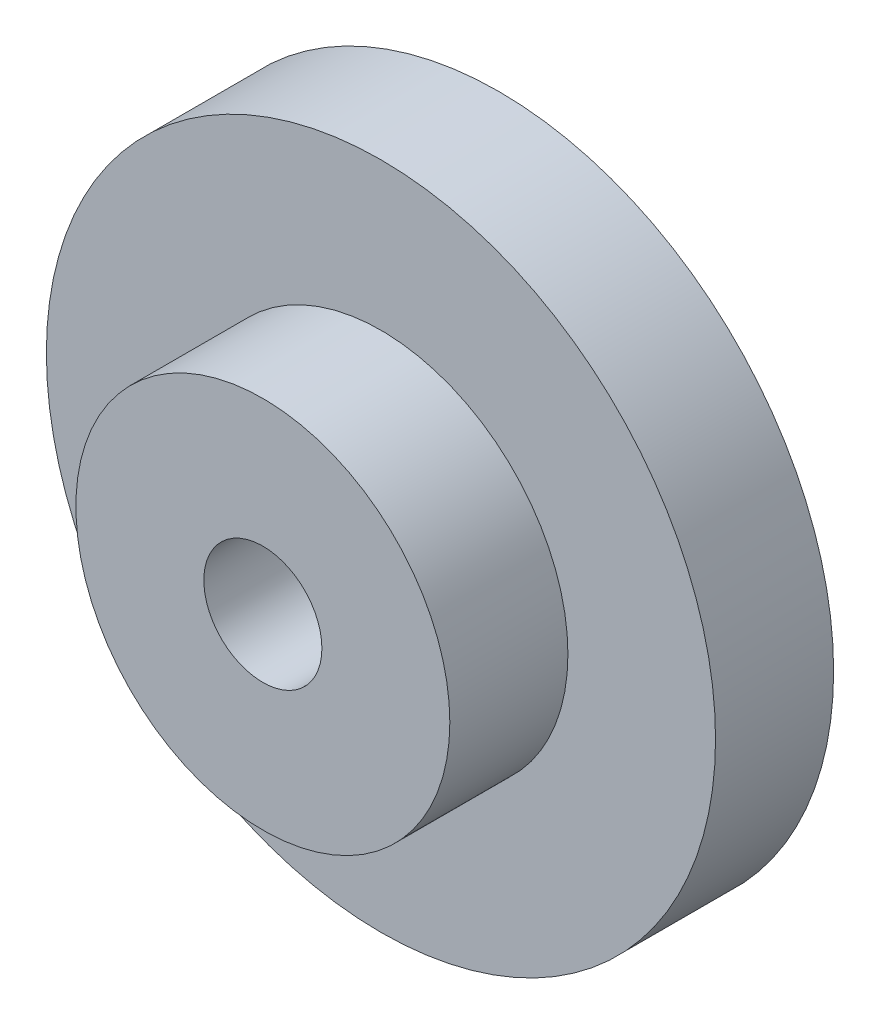
from build123d import *


with BuildPart() as part:
    # Sketch1 → Revolve1 (revolve)
    with BuildSketch(Plane(origin=(0, 0, 0), x_dir=(0, 0, -1), z_dir=(1, 0, 0))):
        Polygon((-3.35483871, 0), (2.64516129, 0), (2.64516129, 7), (-0.35483871, 7), (-0.35483871, 3.25), (-3.35483871, 3.25), align=None)
    revolve(axis=Axis((0, -1.5, 3.35483871), (0, 0, -1)))


solid = part.part
